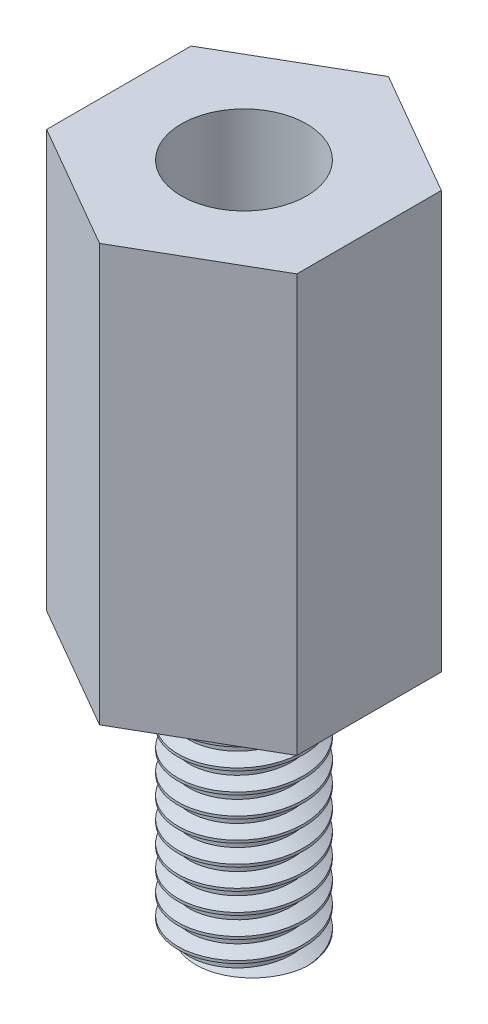
from build123d import *

# Parameters (mm, degrees)
BOSS_EXTRUDE1_DEPTH         = 25
SKETCH2_R                   = 1.5
BOSS_EXTRUDE2_DEPTH         = 6
TAP_DRILL_FOR_M3_TAP1_D     = 2.5
TAP_DRILL_FOR_M3_TAP1_DEPTH = 10
TAP_DRILL_FOR_M3_TAP1_TIP   = 0.751075774
THREAD1_PITCH               = 0.5
THREAD2_PITCH               = 0.5
SKETCH9_R                   = 11.225
SKETCH9_R_2                 = 1.225
CUT_EXTRUDE_THIN1_DEPTH     = 0.5
SKETCH10_R                  = 3.781205246
CUT_EXTRUDE1_DEPTH          = 15
SKETCH11_R                  = 1.5
CUT_EXTRUDE2_DEPTH          = 7


with BuildPart() as part:
    # Sketch1 → Boss-Extrude1 (new body)
    with BuildSketch(Plane(origin=(0, 0, 0), x_dir=(1, 0, 0), z_dir=(0, 1, 0))):
        Polygon((3, 1.732050808), (0, 3.464101615), (-3, 1.732050808), (-3, -1.732050808), (0, -3.464101615), (3, -1.732050808), align=None)
    extrude(amount=BOSS_EXTRUDE1_DEPTH)

    # Sketch2 → Boss-Extrude2 (add)
    with BuildSketch(Plane.XZ):
        with Locations(Location((0, 0, 0), (0, 0, 270))):
            Circle(SKETCH2_R)
    extrude(amount=BOSS_EXTRUDE2_DEPTH)

    # Tap Drill for M3 Tap1
    with Locations(Plane(origin=(0, 25, 0), x_dir=(1, 0, 0), z_dir=(0, 1, 0))):
        with Locations((0, 0)):
            Hole(TAP_DRILL_FOR_M3_TAP1_D / 2, depth=TAP_DRILL_FOR_M3_TAP1_DEPTH)
            with Locations((0, 0, -(TAP_DRILL_FOR_M3_TAP1_DEPTH + TAP_DRILL_FOR_M3_TAP1_TIP / 2))):  # 118° drill point
                Cone(0, TAP_DRILL_FOR_M3_TAP1_D / 2, TAP_DRILL_FOR_M3_TAP1_TIP, mode=Mode.SUBTRACT)

    # Thread1: the profile of Thread Profile1 profile screwed along a right-hand helix of 18 turns, 6 arcs to a turn; built about Z, then put on its axis
    thread1_z = Axis((0, 0, 0), (0, 0, 1))
    thread1_corners = [(1.2497, 0, -0.000173205), (1.520632937, 0, 0.156249999), (1.520632937, 0, 0.218749999), (1.2497, 0, 0.375173204)]
    with BuildLine(mode=Mode.PRIVATE) as thread1_profile:
        Line(thread1_corners[0], thread1_corners[1])
        Line(thread1_corners[1], thread1_corners[2])
        Line(thread1_corners[2], thread1_corners[3])
        Line(thread1_corners[3], thread1_corners[0])
    thread1_cap = Face(thread1_profile.wire())
    thread1_turn_angles = [0, 30, 60, 90, 120, 150, 180, 210, 240, 270, 300, 330, 360]
    thread1_turn_weights = [1, 0.8660254037844387, 1, 0.8660254037844387, 1, 0.8660254037844387, 1, 0.8660254037844387, 1, 0.8660254037844387, 1, 0.8660254037844387, 1]
    thread1_turn_rails = [Edge.make_bspline([Vector(p[0], p[1], 0).rotate(thread1_z, thread1_turn_angles[k]) / thread1_turn_weights[k] + Vector(0, 0, p[2] + THREAD1_PITCH * thread1_turn_angles[k] / 360) for k in range(13)], [0, 0, 0, 1, 1, 2, 2, 3, 3, 4, 4, 5, 5, 6, 6, 6], 2, thread1_turn_weights) for p in thread1_corners]
    thread1_turn_sides = [Face.make_surface_from_curves(thread1_turn_rails[p[0]], thread1_turn_rails[p[1]]) for p in [(0, 1), (1, 2), (2, 3), (3, 0)]]
    thread1 = Plane(origin=(0, 26, 0), x_dir=(-1, 0, 0), z_dir=(0, -1, 0)) * Solid(Shell([*[p.moved(Location((0, 0, THREAD1_PITCH * i))) for i in range(18) for p in thread1_turn_sides], thread1_cap, thread1_cap.rotate(thread1_z, 6480).moved(Location((0, 0, THREAD1_PITCH * 6480 / 360)))]))
    add(thread1, mode=Mode.SUBTRACT)

    # Thread2: the profile of Thread Profile2 profile screwed along a right-hand helix of 13 turns, 6 arcs to a turn; built about Z, then put on its axis
    thread2_z = Axis((0, 0, 0), (0, 0, 1))
    thread2_corners = [(1.5003, 0, -0.000173205), (1.5003, 0, 0.437673204), (1.229367063, 0, 0.281249999), (1.229367063, 0, 0.156249999)]
    with BuildLine(mode=Mode.PRIVATE) as thread2_profile:
        Line(thread2_corners[0], thread2_corners[1])
        Line(thread2_corners[1], thread2_corners[2])
        Line(thread2_corners[2], thread2_corners[3])
        Line(thread2_corners[3], thread2_corners[0])
    thread2_cap = Face(thread2_profile.wire())
    thread2_turn_angles = [0, 30, 60, 90, 120, 150, 180, 210, 240, 270, 300, 330, 360]
    thread2_turn_weights = [1, 0.8660254037844387, 1, 0.8660254037844387, 1, 0.8660254037844387, 1, 0.8660254037844387, 1, 0.8660254037844387, 1, 0.8660254037844387, 1]
    thread2_turn_rails = [Edge.make_bspline([Vector(p[0], p[1], 0).rotate(thread2_z, thread2_turn_angles[k]) / thread2_turn_weights[k] + Vector(0, 0, p[2] + THREAD2_PITCH * thread2_turn_angles[k] / 360) for k in range(13)], [0, 0, 0, 1, 1, 2, 2, 3, 3, 4, 4, 5, 5, 6, 6, 6], 2, thread2_turn_weights) for p in thread2_corners]
    thread2_turn_sides = [Face.make_surface_from_curves(thread2_turn_rails[p[0]], thread2_turn_rails[p[1]]) for p in [(0, 1), (1, 2), (2, 3), (3, 0)]]
    thread2 = Plane(origin=(0, -7, 0), x_dir=(1, 0, 0), z_dir=(0, 1, 0)) * Solid(Shell([*[p.moved(Location((0, 0, THREAD2_PITCH * i))) for i in range(13) for p in thread2_turn_sides], thread2_cap, thread2_cap.rotate(thread2_z, 4680).moved(Location((0, 0, THREAD2_PITCH * 4680 / 360)))]))
    add(thread2, mode=Mode.SUBTRACT)

    # Sketch9 → Cut-Extrude-Thin1 (cut)
    with BuildSketch(Plane(origin=(0, 0, 0), x_dir=(1, 0, 0), z_dir=(0, 1, 0))):
        Circle(SKETCH9_R)
        Circle(SKETCH9_R_2, mode=Mode.SUBTRACT)
    extrude(amount=-CUT_EXTRUDE_THIN1_DEPTH, mode=Mode.SUBTRACT)

    # Sketch10 → Cut-Extrude1 (cut)
    with BuildSketch(Plane(origin=(0, 25, 0), x_dir=(1, 0, 0), z_dir=(0, 1, 0))):
        Circle(SKETCH10_R)
    extrude(amount=-CUT_EXTRUDE1_DEPTH, mode=Mode.SUBTRACT)

    # Sketch11 → Cut-Extrude2 (cut)
    with BuildSketch(Plane(origin=(0, 10, 0), x_dir=(1, 0, 0), z_dir=(0, 1, 0))):
        with Locations(Location((0, 0, 0), (0, 0, 270))):
            Circle(SKETCH11_R)
    extrude(amount=-CUT_EXTRUDE2_DEPTH, mode=Mode.SUBTRACT)


solid = part.part
